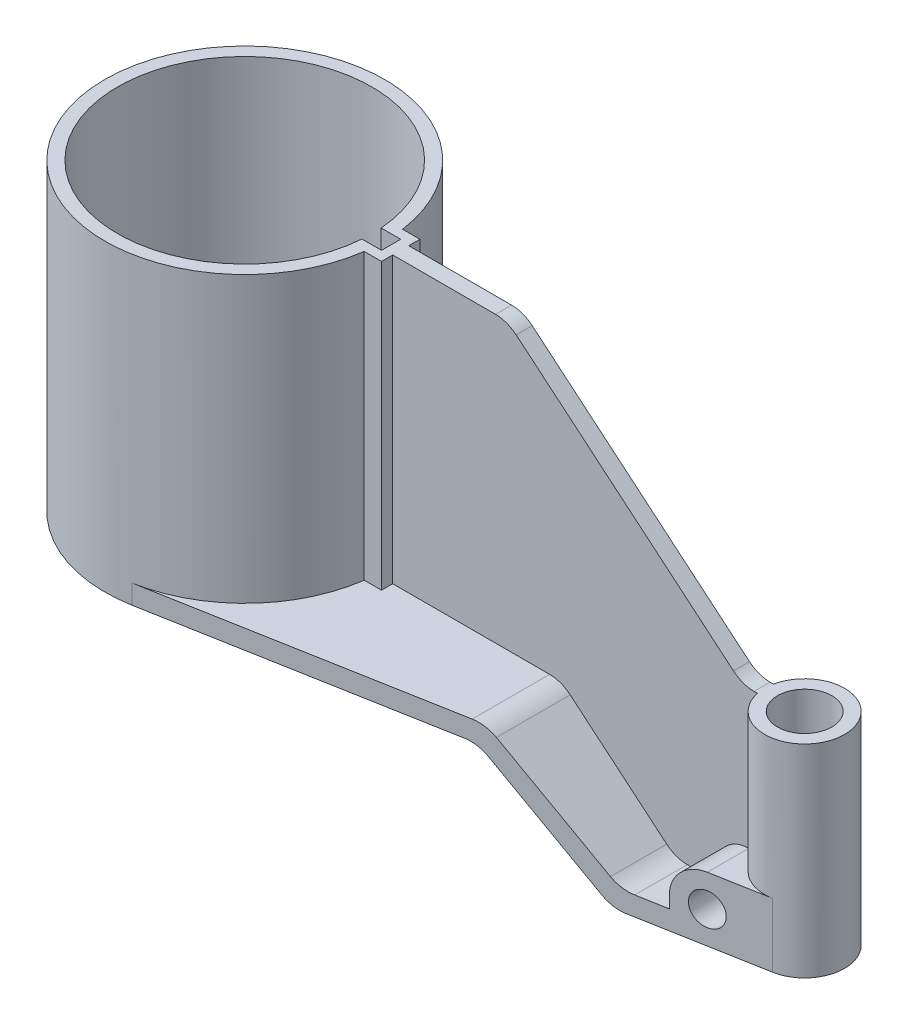
from build123d import *

# Parameters (mm, degrees)
BOSS_EXTRUDE1_DEPTH     = 95
BOSS_EXTRUDE2_START     = -30
SKETCH2_3_R             = 12.5
BOSS_EXTRUDE2_DEPTH     = 63.333333333
EXTRUDE_THIN1_DEPTH     = 115
SKETCH5_W               = 50
SKETCH5_H               = 20
BOSS_EXTRUDE3_DEPTH     = 230
CUT_EXTRUDE2_DEPTH      = 320.256949807
CUT_EXTRUDE2_DEPTH_BACK = 320.256949807
SKETCH5_3_R             = 5
CUT_EXTRUDE1_START      = -30
CUT_EXTRUDE1_OUTLINE_R  = 8.5
CUT_EXTRUDE1_DEPTH      = 125
RIB1_START              = -2.5
RIB1_DEPTH              = 5
FILLET1_R               = 10


# Read off the part's stored shape, not the designer's step: Cut-Extrude1, Rib1
with BuildPart() as part:
    # Sketch2 → Boss-Extrude1 (new body)
    with BuildSketch(Plane(origin=(0, 0, 0), x_dir=(1, 0, 0), z_dir=(0, 1, 0))):
        with BuildLine():
            Line((43.336618465, 6), (48.75, 6))
            Line((48.75, 6), (48.75, -6))
            Line((48.75, -6), (43.336618465, -6))
            ThreePointArc((43.336618465, -6), (-43.75, 0), (43.336618465, 6))
        make_face()
    extrude(amount=BOSS_EXTRUDE1_DEPTH)



with BuildPart() as body_2:
    # Sketch2<3> → Boss-Extrude2 (new body)
    with BuildSketch(Plane(origin=(0, 0, 0), x_dir=(1, 0, 0), z_dir=(0, 1, 0)).offset(BOSS_EXTRUDE2_START)):
        with Locations(Location((175, 0, 0), (0, 0, 270))):
            Circle(SKETCH2_3_R)
    extrude(amount=BOSS_EXTRUDE2_DEPTH)


with BuildPart() as part_1:
    add(part.part)

    add(body_2.part)  # Extrude-Thin1 merges body 2
    # Sketch3 → Extrude-Thin1 (add, symmetric)
    with BuildSketch(Plane.XY):
        Polygon((-43.75, 0), (99.247392222, 0), (135, -30), (187.5, -30), (187.5, -24), (137.183821406, -24), (101.431213628, 6), (-43.75, 6), align=None)
    extrude(amount=EXTRUDE_THIN1_DEPTH, both=True)

    # Sketch5 → Boss-Extrude3 (add)
    with BuildSketch(Plane.XY.offset(115)):
        with Locations((175, -20)):
            Rectangle(SKETCH5_W, SKETCH5_H)
    extrude(amount=-BOSS_EXTRUDE3_DEPTH)

    # Sketch5<3> → Cut-Extrude2 (cut, two sides: drawn at the far end of the back side and taken through both)
    with BuildSketch(Plane.XY.offset(115).offset(-CUT_EXTRUDE2_DEPTH_BACK)):
        with Locations((160, -20)):
            Circle(SKETCH5_3_R)
    extrude(amount=CUT_EXTRUDE2_DEPTH + CUT_EXTRUDE2_DEPTH_BACK, mode=Mode.SUBTRACT)

    # Cut-Extrude1 outline → Cut-Extrude1 (cut)
    with BuildSketch(Plane(origin=(0, 0, 0), x_dir=(1, 0, 0), z_dir=(0, 1, 0)).offset(CUT_EXTRUDE1_START)):
        with BuildLine():
            ThreePointArc((177.232142857, 12.299086887), (184.59561842, 8.010874306), (187.5, 0))
            ThreePointArc((187.5, 0), (184.59561842, -8.010874306), (177.232142857, -12.299086887))
            Line((177.232142857, -12.299086887), (150, -17.241407705))
            Line((150, -17.241407705), (150, -115))
            Line((150, -115), (200, -115))
            Line((200, -115), (200, 115))
            Line((200, 115), (150, 115))
            Line((150, 115), (150, 17.241407705))
            Line((150, 17.241407705), (177.232142857, 12.299086887))
        make_face()
        with BuildLine():
            Line((7.8125, 43.046804106), (150, 17.241407705))
            Line((150, 17.241407705), (150, 115))
            Line((150, 115), (-43.75, 115))
            Line((-43.75, 115), (-43.75, -4.5e-08))
            ThreePointArc((-43.75, -4.5e-08), (-28.038060087, 33.584664455), (7.8125, 43.046804106))
        make_face()
        with BuildLine():
            Line((150, -115), (150, -17.241407705))
            Line((150, -17.241407705), (7.8125, -43.046804106))
            ThreePointArc((7.8125, -43.046804106), (-28.038060053, -33.584664483), (-43.75, -4.5e-08))
            Line((-43.75, -4.5e-08), (-43.75, -115))
            Line((-43.75, -115), (150, -115))
        make_face()
        with Locations((175, 0)):
            Circle(CUT_EXTRUDE1_OUTLINE_R)
        with BuildLine():
            Line((45.75, 3), (39.636630785, 3))
            ThreePointArc((39.636630785, 3), (-39.75, 0), (39.636630785, -3))
            Line((39.636630785, -3), (45.75, -3))
            Line((45.75, -3), (45.75, 3))
        make_face()
    extrude(amount=CUT_EXTRUDE1_DEPTH, mode=Mode.SUBTRACT)

    # Rib1 outline → Rib1 (add)
    with BuildSketch(Plane.XY.offset(RIB1_START)):
        Polygon((158.05144817, 33.333333333), (84.559976627, 95), (48.75, 95), (48.75, 6), (101.431213628, 6), (137.183821406, -24), (150, -24), (150, -10), (164, -10), (164, 33.333333333), align=None)
    extrude(amount=RIB1_DEPTH)

    # Fillet1
    fillet1_edges = [part_1.edges().sort_by_distance(p)[0] for p in [
        (150, -10, 9.870703853),
        (137.183821406, -24, -11.033698381),
        (101.431213628, 6, -14.278041998),
        (158.05144817, 33.333333333, 0),
        (84.559976627, 95, 0),
        (150, -10, -9.870703853),
        (99.247392222, 0, 0),
        (101.431213628, 6, 14.278041998),
        (137.183821406, -24, 11.033698381),
        (135, -30, 0),
    ]]
    fillet(fillet1_edges, radius=FILLET1_R)


solid = part_1.part
